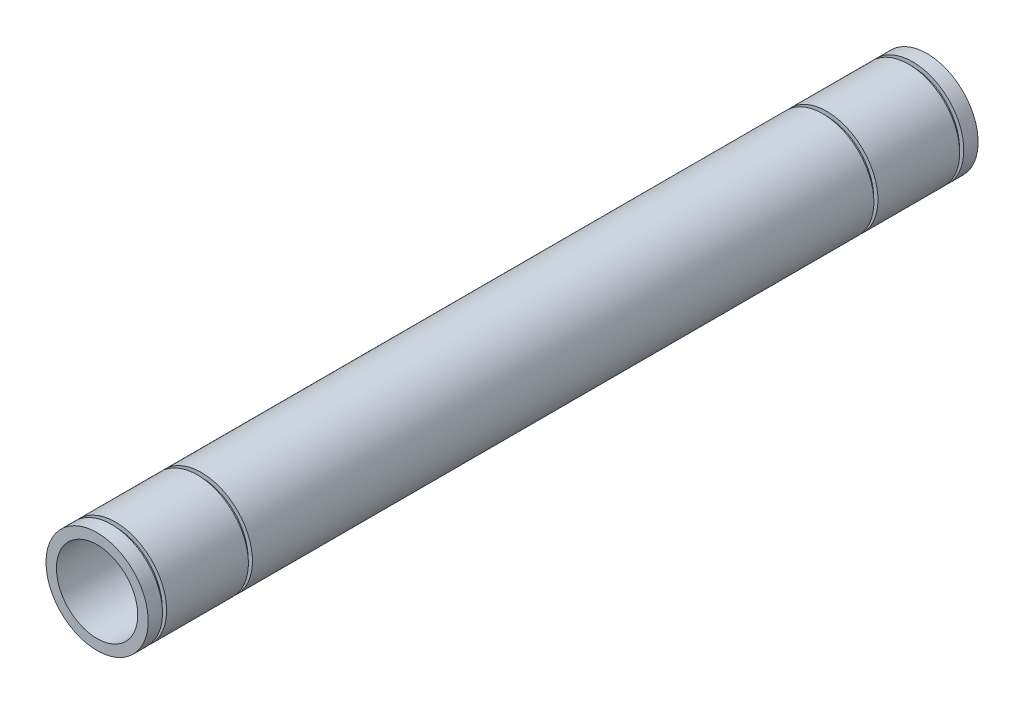
from build123d import *

# Parameters (mm, degrees)
SKETCH1_R   = 25
SKETCH1_R_2 = 19.9
BODY_DEPTH  = 406
SKETCH2_W   = 2
SKETCH2_H   = 2.1


with BuildPart() as part:
    # Sketch1 → Body (new body)
    with BuildSketch(Plane.XY):
        Circle(SKETCH1_R)
        Circle(SKETCH1_R_2, mode=Mode.SUBTRACT)
    extrude(amount=BODY_DEPTH)

    # Sketch2 → Ret Ring Grooves (revolve, cut)
    with BuildSketch(Plane(origin=(0, 0, 0), x_dir=(0, 0, -1), z_dir=(1, 0, 0))):
        with Locations((-398, 23.95)):
            Rectangle(SKETCH2_W, SKETCH2_H)
        with Locations((-356, 23.95)):
            Rectangle(SKETCH2_W, SKETCH2_H)
        with Locations((-50, 23.95)):
            Rectangle(SKETCH2_W, SKETCH2_H)
        with Locations((-8, 23.95)):
            Rectangle(SKETCH2_W, SKETCH2_H)
    revolve(axis=Axis((0, 0, 0), (0, 0, 1)), mode=Mode.SUBTRACT)


solid = part.part
